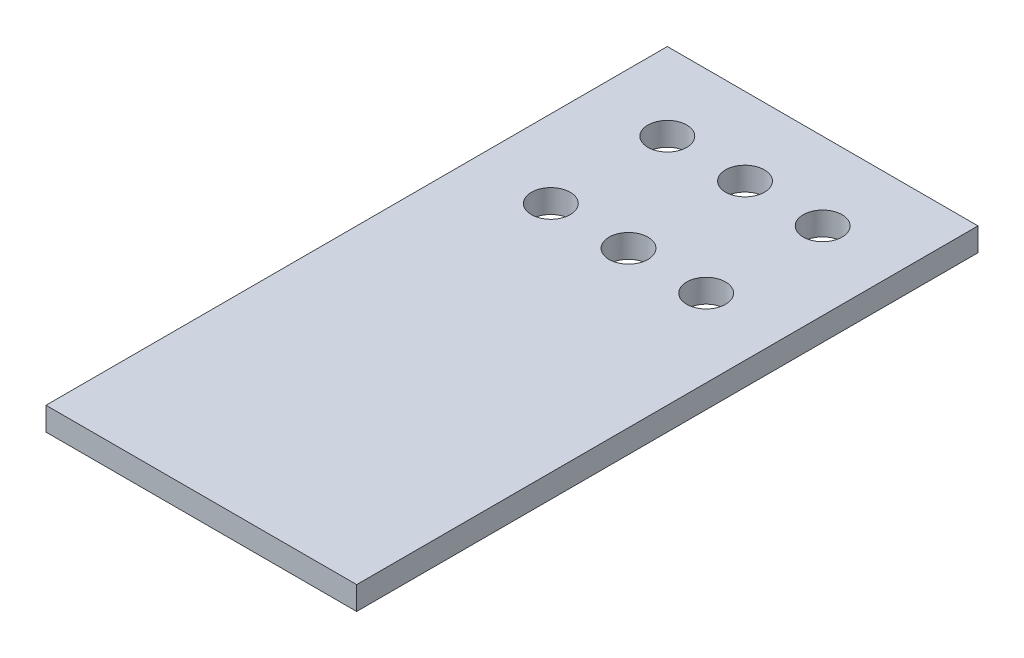
from build123d import *

# Parameters (mm, degrees)
SKETCH1_W            = 50.8
SKETCH1_H            = 101.6
BOSS_EXTRUDE1_DEPTH  = 3.81
SKETCH2_R            = 3.175
CUT_EXTRUDE1_DEPTH   = 6.35
LPATTERN1_COUNT      = 2
LPATTERN1_PITCH      = 19.05
LPATTERN1_COUNT_DIR2 = 3
LPATTERN1_PITCH_DIR2 = 12.7


with BuildPart() as part:
    # Sketch1 → Boss-Extrude1 (new body)
    with BuildSketch(Plane(origin=(0, 0, 0), x_dir=(1, 0, 0), z_dir=(0, 1, 0))):
        Rectangle(SKETCH1_W, SKETCH1_H)
    extrude(amount=BOSS_EXTRUDE1_DEPTH)

    # Sketch2 → Cut-Extrude1 (cut)
    with BuildSketch(Plane(origin=(0, 3.81, 0), x_dir=(1, 0, 0), z_dir=(0, 1, 0))):
        with Locations((-12.7, 19.05)):
            Circle(SKETCH2_R)
    cut_extrude1 = extrude(amount=-CUT_EXTRUDE1_DEPTH, mode=Mode.SUBTRACT)

    # LPattern1: Cut-Extrude1 2 × 3
    with Locations(*[(j * LPATTERN1_PITCH_DIR2, 0, -i * LPATTERN1_PITCH) for i in range(LPATTERN1_COUNT) for j in range(LPATTERN1_COUNT_DIR2) if (i, j) != (0, 0)]):
        add(cut_extrude1, mode=Mode.SUBTRACT)


solid = part.part
